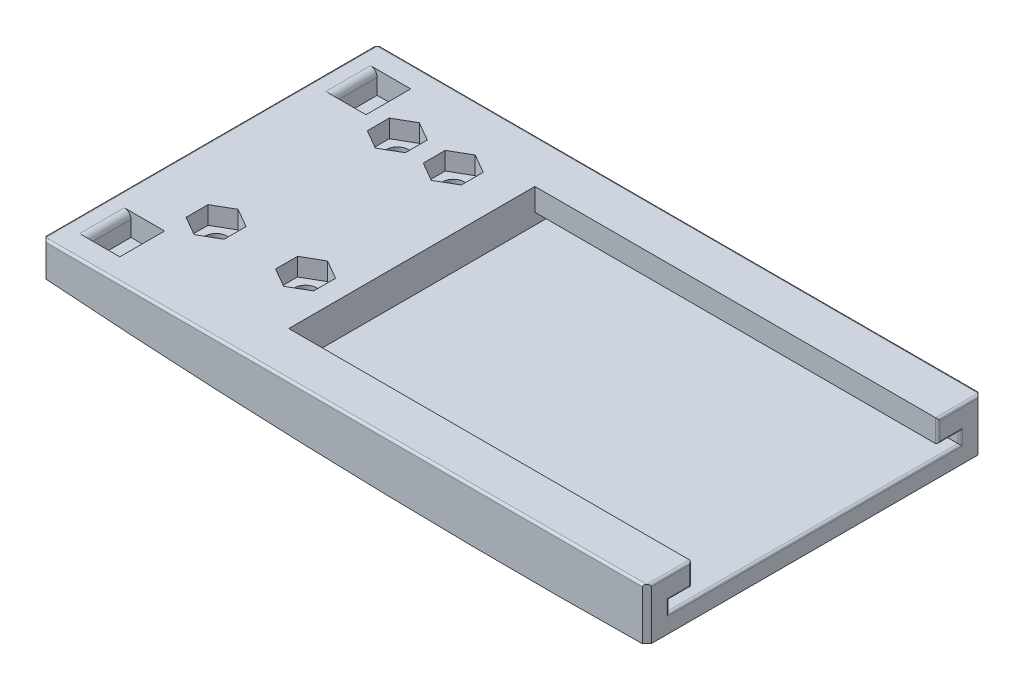
from build123d import *

# Parameters (mm, degrees)
SKETCH1_W               = 270.5
SKETCH1_H               = 150
BOSS_EXTRUDE1_DEPTH     = 15
BOSS_EXTRUDE5_DEPTH     = 150
CUT_EXTRUDE7_DEPTH      = 311.185801218
CUT_EXTRUDE7_DEPTH_BACK = 311.185801218
SKETCH5_R               = 5
CUT_EXTRUDE8_DEPTH      = 8
CUT_EXTRUDE9_DEPTH      = 180
CHAMFER1_SIZE           = 2
SKETCH16_W              = 15
SKETCH16_H              = 20
CUT_EXTRUDE10_DEPTH     = 10
FILLET2_R               = 1
FILLET3_R               = 3


with BuildPart() as part:
    # Sketch1 → Boss-Extrude1 (new body)
    with BuildSketch(Plane(origin=(0, 0, 0), x_dir=(1, 0, 0), z_dir=(0, 1, 0))):
        with Locations((135.25, 75)):
            Rectangle(SKETCH1_W, SKETCH1_H)
    extrude(amount=BOSS_EXTRUDE1_DEPTH)

    # Sketch12 → Boss-Extrude5 (add)
    with BuildSketch(Plane.XY.offset(-150)):
        with BuildLine():
            Line((270.5, 0), (270.5, -7.956989195))
            ThreePointArc((270.5, -7.956989195), (135.159339828, -7.060511664), (0, 0))
            Line((0, 0), (270.5, 0))
        make_face()
    extrude(amount=BOSS_EXTRUDE5_DEPTH)

    # Sketch5 → Cut-Extrude7 (cut, two sides: drawn at the far end of the back side and taken through both)
    with BuildSketch(Plane(origin=(0, 15, 0), x_dir=(1, 0, 0), z_dir=(0, 1, 0)).offset(-CUT_EXTRUDE7_DEPTH_BACK)):
        with Locations(Location((33, 45, 0), (0, 0, 270))):
            Circle(SKETCH5_R)
        with Locations(Location((40, 119, 0), (0, 0, 270))):
            Circle(SKETCH5_R)
        with Locations(Location((65, 119, 0), (0, 0, 270))):
            Circle(SKETCH5_R)
        with Locations(Location((73, 45, 0), (0, 0, 270))):
            Circle(SKETCH5_R)
    extrude(amount=CUT_EXTRUDE7_DEPTH + CUT_EXTRUDE7_DEPTH_BACK, mode=Mode.SUBTRACT)

    # Sketch13 → Cut-Extrude8 (cut)
    with BuildSketch(Plane(origin=(0, 15, 0), x_dir=(1, 0, 0), z_dir=(0, 1, 0))):
        Polygon((40, 109.185045424), (48.5, 114.092522712), (48.5, 123.907477288), (40, 128.814954576), (31.5, 123.907477288), (31.5, 114.092522712), align=None)
        Polygon((65, 109.185045424), (73.5, 114.092522712), (73.5, 123.907477288), (65, 128.814954576), (56.5, 123.907477288), (56.5, 114.092522712), align=None)
        Polygon((33, 35.185045424), (41.5, 40.092522712), (41.5, 49.907477288), (33, 54.814954576), (24.5, 49.907477288), (24.5, 40.092522712), align=None)
        Polygon((73, 35.185045424), (81.5, 40.092522712), (81.5, 49.907477288), (73, 54.814954576), (64.5, 49.907477288), (64.5, 40.092522712), align=None)
    extrude(amount=-CUT_EXTRUDE8_DEPTH, mode=Mode.SUBTRACT)

    # Sketch15 → Cut-Extrude9 (cut)
    with BuildSketch(Plane(origin=(270.5, 0, 0), x_dir=(0, 0, -1), z_dir=(1, 0, 0))):
        Polygon((20, 15), (130, 15), (130, 5), (140, 5), (140, 0), (10, 0), (10, 5), (20, 5), align=None)
    extrude(amount=-CUT_EXTRUDE9_DEPTH, mode=Mode.SUBTRACT)

    # Chamfer1
    chamfer1_edges = [part.edges().sort_by_distance(p)[0] for p in [
        (0, 7.5, -150),
        (270.5, 3.521505402, -150),
        (270.5, 3.521505402, 0),
        (0, 7.5, 0),
    ]]
    chamfer(chamfer1_edges, length=CHAMFER1_SIZE)

    # Sketch16 → Cut-Extrude10 (cut)
    with BuildSketch(Plane(origin=(0, 15, 0), x_dir=(1, 0, 0), z_dir=(0, 1, 0))):
        with Locations((17.5, 20)):
            Rectangle(SKETCH16_W, SKETCH16_H)
        with Locations((17.5, 130)):
            Rectangle(SKETCH16_W, SKETCH16_H)
    extrude(amount=-CUT_EXTRUDE10_DEPTH, mode=Mode.SUBTRACT)

    # Fillet2
    fillet2_edges = [part.edges().sort_by_distance(p)[0] for p in [
        (270.5, 15, -139),
        (270.5, 10, -130),
        (270.5, 5, -135),
        (270.5, 2.5, -140),
        (270.5, 0, -75),
        (270.5, 2.5, -10),
        (270.5, 5, -15),
        (270.5, 10, -20),
        (270.5, 15, -11),
        (135.25, 15, -150),
        (135.25, 15, 0),
        (0, 15, -75),
    ]]
    fillet(fillet2_edges, radius=FILLET2_R - 0.0001)  # a hair under: the kernel refuses the full size

    # Fillet3
    fillet3_edges = [part.edges().sort_by_distance(p)[0] for p in [
        (10, 15, -130),
        (10, 15, -20),
    ]]
    fillet(fillet3_edges, radius=FILLET3_R)


solid = part.part
